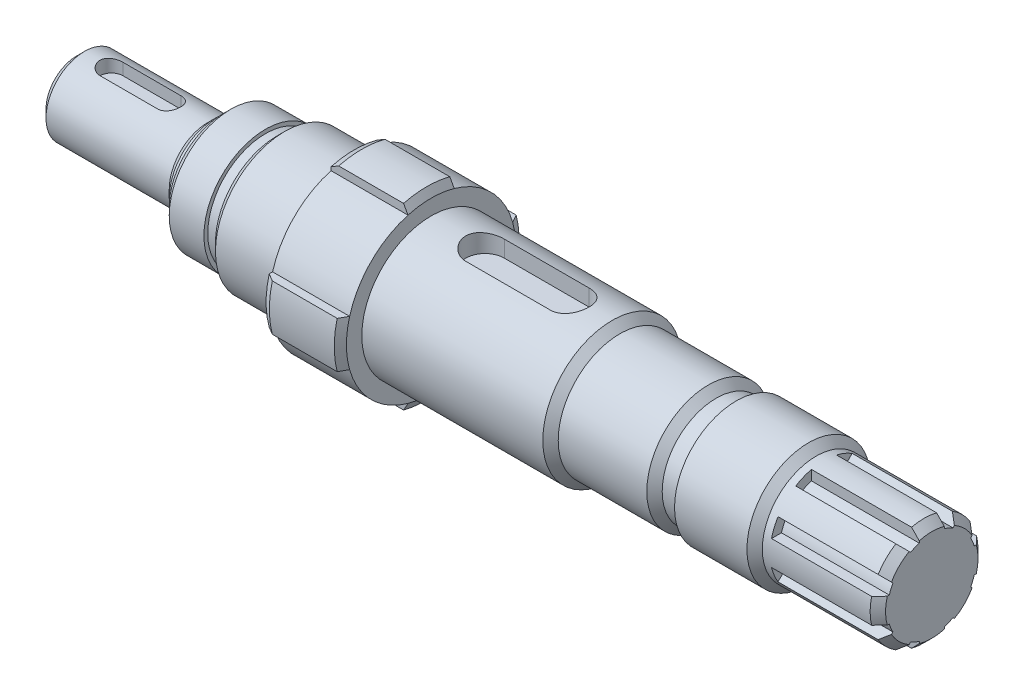
from build123d import *
from OCP.BRepFilletAPI import BRepFilletAPI_MakeChamfer

# Parameters (mm, degrees)
CHAFL_N1_SIZE         = 2
CHAFL_N2_SIZE         = 2
CHAFL_N3_SIZE         = 2
CHAFL_N3_SIZE2        = 1.154700538
CHAFL_N4_SIZE         = 2
CORTAR_EXTRUIR1_DEPTH = 3.5
CORTAR_EXTRUIR2_DEPTH = 5
CORTAR_EXTRUIR3_DEPTH = 135.357731449
CORTAR_EXTRUIR4_DEPTH = 28


with BuildPart() as part:
    # Croquis1 → Revolución1 (revolve)
    with BuildSketch(Plane.XY, mode=Mode.PRIVATE) as revoluci_n1_sk:
        Polygon((0, 0), (0, 10), (34, 10), (34, 12), (38, 12), (38, 16), (49, 16), (49, 15), (52, 15), (52, 18), (72, 18), (72, 24), (92, 24), (92, 18), (141, 18), (141, 16), (166, 16), (166, 14), (171.200926143, 14), (171.200926143, 16), (192, 16), (192, 14), (222, 14), (222, 0), align=None)
    revolve(revoluci_n1_sk.sketch.rotate(Axis((0, 0, 0), (1, 0, 0)), 90), axis=Axis((0, 0, 0), (1, 0, 0)))

    # Chaflán1
    chafl_n1_edges = [part.edges().sort_by_distance(p)[0] for p in [
        (192, 0, -16),
        (166, 0, -16),
        (141, 0, -18),
        (34, 0, -12),
        (0, 0, -10),
    ]]
    chamfer(chafl_n1_edges, length=CHAFL_N1_SIZE - 0.0001)  # a hair under: the kernel refuses the full size

    # Chaflán2
    chafl_n2_edges = [part.edges().sort_by_distance(p)[0] for p in [
        (52, 0, -18),
        (38, 0, -16),
    ]]
    chamfer(chafl_n2_edges, length=CHAFL_N2_SIZE)

    # Chaflán3: one chamfer whose edges measure the first distance from different faces: ONE call of the kernel's chamfer builder (chamfer() names one face for all edges)
    chafl_n3_edges_1 = [part.edges().sort_by_distance(p)[0] for p in [
        (92, 0, -24),
    ]]
    chafl_n3_side_1 = [part.faces().sort_by_distance(p)[0] for p in [
        (92, 0, -23.32117749),
    ]]
    chafl_n3_edges_2 = [part.edges().sort_by_distance(p)[0] for p in [
        (72, 0, -24),
    ]]
    chafl_n3_side_2 = [part.faces().sort_by_distance(p)[0] for p in [
        (82, 0, -24),
    ]]
    chafl_n3 = BRepFilletAPI_MakeChamfer(part.part.solid().wrapped)
    for e in chafl_n3_edges_1:
        chafl_n3.Add(CHAFL_N3_SIZE, CHAFL_N3_SIZE2, e.wrapped, chafl_n3_side_1[0].wrapped)  # the first distance lies on this face
    for e in chafl_n3_edges_2:
        chafl_n3.Add(CHAFL_N3_SIZE, CHAFL_N3_SIZE2, e.wrapped, chafl_n3_side_2[0].wrapped)  # the first distance lies on this face
    add(Compound.cast(chafl_n3.Shape()), mode=Mode.REPLACE)

    # Chaflán4
    chafl_n4_edges = [part.edges().sort_by_distance(p)[0] for p in [
        (222, 0, -14),
    ]]
    chamfer(chafl_n4_edges, length=CHAFL_N4_SIZE)

    # Croquis3 → Cortar-Extruir1 (cut)
    with BuildSketch(Plane(origin=(0, 10, 0), x_dir=(1, 0, 0), z_dir=(0, 1, 0))):
        with BuildLine():
            Line((9, 3), (24, 3))
            ThreePointArc((24, 3), (27, 0), (24, -3))
            Line((24, -3), (9, -3))
            ThreePointArc((9, -3), (6, 0), (9, 3))
        make_face()
    extrude(amount=-CORTAR_EXTRUIR1_DEPTH, mode=Mode.SUBTRACT)

    # Croquis5 → Cortar-Extruir2 (cut)
    with BuildSketch(Plane(origin=(0, 18, 0), x_dir=(1, 0, 0), z_dir=(0, 1, 0))):
        with BuildLine():
            Line((106, 5), (128, 5))
            ThreePointArc((128, 5), (133, 0), (128, -5))
            Line((128, -5), (106, -5))
            ThreePointArc((106, -5), (101, 0), (106, 5))
        make_face()
    extrude(amount=-CORTAR_EXTRUIR2_DEPTH, mode=Mode.SUBTRACT)

    # Croquis7 → Cortar-Extruir3 (cut, through all)
    with BuildSketch(Plane(origin=(92, 0, 0), x_dir=(0, 0, -1), z_dir=(1, 0, 0))):
        with BuildLine():
            Line((-6, 21.166010489), (-6, 23.237900077))
            ThreePointArc((-6, 23.237900077), (-16.970562748, 16.970562748), (-23.237900077, 6))
            Line((-23.237900077, 6), (-21.166010489, 6))
            ThreePointArc((-21.166010489, 6), (-15.556349186, 15.556349186), (-6, 21.166010489))
        make_face()
        with BuildLine():
            ThreePointArc((23.237900077, 6), (16.970562748, 16.970562748), (6, 23.237900077))
            Line((6, 23.237900077), (6, 21.166010489))
            ThreePointArc((6, 21.166010489), (15.556349186, 15.556349186), (21.166010489, 6))
            Line((21.166010489, 6), (23.237900077, 6))
        make_face()
        with BuildLine():
            Line((-21.166010489, -6), (-23.237900077, -6))
            ThreePointArc((-23.237900077, -6), (-16.970562748, -16.970562748), (-6, -23.237900077))
            Line((-6, -23.237900077), (-6, -21.166010489))
            ThreePointArc((-6, -21.166010489), (-15.556349186, -15.556349186), (-21.166010489, -6))
        make_face()
        with BuildLine():
            ThreePointArc((6, -23.237900077), (16.970562748, -16.970562748), (23.237900077, -6))
            Line((23.237900077, -6), (21.166010489, -6))
            ThreePointArc((21.166010489, -6), (15.556349186, -15.556349186), (6, -21.166010489))
            Line((6, -21.166010489), (6, -23.237900077))
        make_face()
    extrude(amount=-CORTAR_EXTRUIR3_DEPTH, mode=Mode.SUBTRACT)

    # Croquis8 → Cortar-Extruir4 (cut)
    with BuildSketch(Plane(origin=(222, 0, 0), x_dir=(0, 0, -1), z_dir=(1, 0, 0))):
        with BuildLine():
            Line((-3.25, 13.617543831), (-3.25, 11.031205736))
            ThreePointArc((-3.25, 11.031205736), (-4.400859472, 10.624614624), (-5.502143342, 10.09833742))
            Line((-5.502143342, 10.09833742), (-7.330960547, 11.927154625))
            ThreePointArc((-7.330960547, 11.927154625), (-5.357568053, 12.934313455), (-3.25, 13.617543831))
        make_face()
        with BuildLine():
            Line((3.25, 13.617543831), (3.25, 11.031205736))
            ThreePointArc((3.25, 11.031205736), (4.400859472, 10.624614624), (5.502143342, 10.09833742))
            Line((5.502143342, 10.09833742), (7.330960547, 11.927154625))
            ThreePointArc((7.330960547, 11.927154625), (5.357568053, 12.934313455), (3.25, 13.617543831))
        make_face()
        with BuildLine():
            Line((11.927154625, 7.330960547), (10.09833742, 5.502143342))
            ThreePointArc((10.09833742, 5.502143342), (10.624614624, 4.400859472), (11.031205736, 3.25))
            Line((11.031205736, 3.25), (13.617543831, 3.25))
            ThreePointArc((13.617543831, 3.25), (12.934313455, 5.357568053), (11.927154625, 7.330960547))
        make_face()
        with BuildLine():
            Line((13.617543831, -3.25), (11.031205736, -3.25))
            ThreePointArc((11.031205736, -3.25), (10.624614624, -4.400859472), (10.09833742, -5.502143342))
            Line((10.09833742, -5.502143342), (11.927154625, -7.330960547))
            ThreePointArc((11.927154625, -7.330960547), (12.934313455, -5.357568053), (13.617543831, -3.25))
        make_face()
        with BuildLine():
            Line((7.330960547, -11.927154625), (5.502143342, -10.09833742))
            ThreePointArc((5.502143342, -10.09833742), (4.400859472, -10.624614624), (3.25, -11.031205736))
            Line((3.25, -11.031205736), (3.25, -13.617543831))
            ThreePointArc((3.25, -13.617543831), (5.357568053, -12.934313455), (7.330960547, -11.927154625))
        make_face()
        with BuildLine():
            Line((-3.25, -13.617543831), (-3.25, -11.031205736))
            ThreePointArc((-3.25, -11.031205736), (-4.400859472, -10.624614624), (-5.502143342, -10.09833742))
            Line((-5.502143342, -10.09833742), (-7.330960547, -11.927154625))
            ThreePointArc((-7.330960547, -11.927154625), (-5.357568053, -12.934313455), (-3.25, -13.617543831))
        make_face()
        with BuildLine():
            Line((-11.927154625, -7.330960547), (-10.09833742, -5.502143342))
            ThreePointArc((-10.09833742, -5.502143342), (-10.624614624, -4.400859472), (-11.031205736, -3.25))
            Line((-11.031205736, -3.25), (-13.617543831, -3.25))
            ThreePointArc((-13.617543831, -3.25), (-12.934313455, -5.357568053), (-11.927154625, -7.330960547))
        make_face()
        with BuildLine():
            Line((-13.617543831, 3.25), (-11.031205736, 3.25))
            ThreePointArc((-11.031205736, 3.25), (-10.624614624, 4.400859472), (-10.09833742, 5.502143342))
            Line((-10.09833742, 5.502143342), (-11.927154625, 7.330960547))
            ThreePointArc((-11.927154625, 7.330960547), (-12.934313455, 5.357568053), (-13.617543831, 3.25))
        make_face()
    extrude(amount=-CORTAR_EXTRUIR4_DEPTH, mode=Mode.SUBTRACT)


solid = part.part
